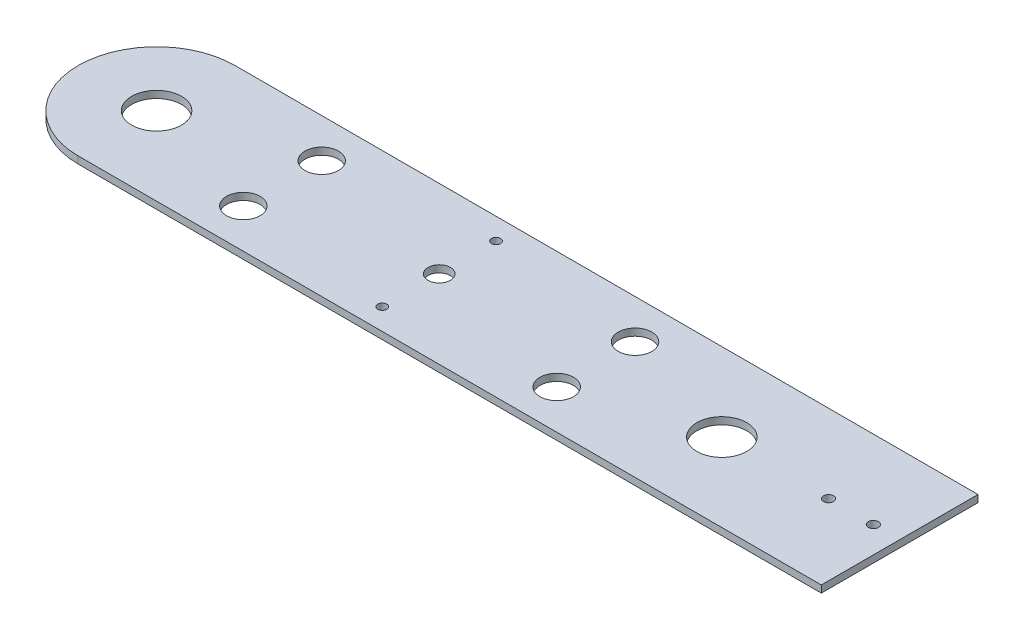
from build123d import *

# Parameters (mm, degrees)
SKETCH1_R           = 11.15
SKETCH1_R_2         = 7.5
SKETCH1_R_3         = 2.02
SKETCH1_R_4         = 2.25
BOSS_EXTRUDE1_DEPTH = 3.175


with BuildPart() as part:
    # Sketch1 → Boss-Extrude1 (new body)
    with BuildSketch(Plane(origin=(0, 0, 0), x_dir=(1, 0, 0), z_dir=(0, 1, 0))):
        with BuildLine():
            ThreePointArc((-126.258214395, 35), (-161.258214395, 0), (-126.258214395, -35))
            Line((-126.258214395, -35), (205.708214395, -35))
            Line((205.708214395, -35), (205.708214395, 35))
            Line((205.708214395, 35), (-126.258214395, 35))
        make_face()
        with Locations((-126.258214395, 0)):
            Circle(SKETCH1_R, mode=Mode.SUBTRACT)
        with Locations((-70, -17.5)):
            Circle(SKETCH1_R_2, mode=Mode.SUBTRACT)
        with Locations((0, -25.4)):
            Circle(SKETCH1_R_3, mode=Mode.SUBTRACT)
        with BuildLine():
            ThreePointArc((5, 0), (0, -5), (-5, 0))
            ThreePointArc((-5, 0), (0, 5), (5, 0))
        make_face(mode=Mode.SUBTRACT)
        with Locations((70, -17.5)):
            Circle(SKETCH1_R_2, mode=Mode.SUBTRACT)
        with Locations((173.958214395, 0)):
            Circle(SKETCH1_R_4, mode=Mode.SUBTRACT)
        with Locations((193.958214395, 0)):
            Circle(SKETCH1_R_4, mode=Mode.SUBTRACT)
        with Locations((-70, 17.5)):
            Circle(SKETCH1_R_2, mode=Mode.SUBTRACT)
        with Locations((0, 25.4)):
            Circle(SKETCH1_R_3, mode=Mode.SUBTRACT)
        with Locations((70, 17.5)):
            Circle(SKETCH1_R_2, mode=Mode.SUBTRACT)
        with Locations((126.258214395, 0)):
            Circle(SKETCH1_R, mode=Mode.SUBTRACT)
    extrude(amount=BOSS_EXTRUDE1_DEPTH)


solid = part.part
